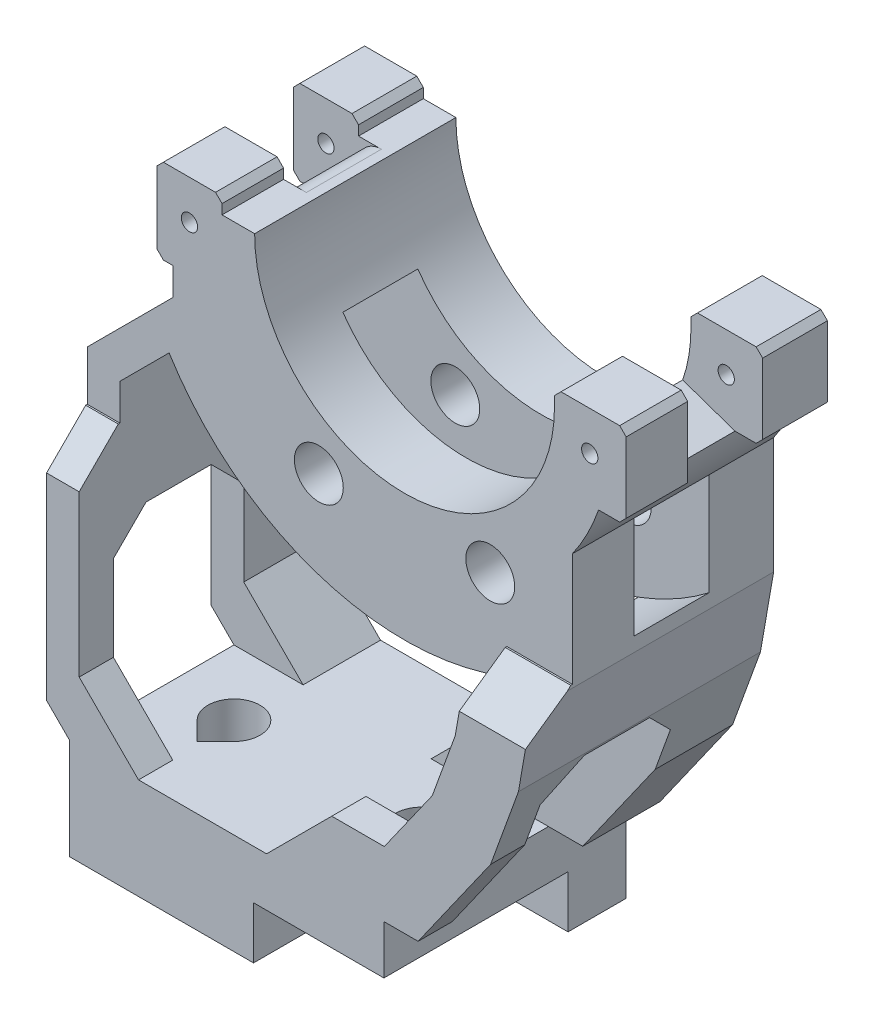
from build123d import *

# Parameters (mm, degrees)
BOSS_EXTRUDE1_DEPTH             = 3.2
BOSS_EXTRUDE2_START             = 3
SKETCH1_3_W                     = 19.3
SKETCH1_3_H                     = 14.85
BOSS_EXTRUDE2_DEPTH             = 3
BOSS_EXTRUDE3_DEPTH             = 3.6
BOSS_EXTRUDE3_DEPTH_BACK        = 8.75
BOSS_EXTRUDE4_REACH             = 42.113
BOSS_EXTRUDE4_DIRECTION_2_REACH = 42.113
CHAMFER1_SIZE                   = 2.4
CUT_EXTRUDE1_DEPTH              = 4
CUT_EXTRUDE1_DEPTH_BACK         = 4
CHAMFER2_SIZE                   = 2
BOSS_EXTRUDE5_START             = -6.175
BOSS_EXTRUDE5_DEPTH             = 12.35
CUT_EXTRUDE2_START              = -2.2
CUT_EXTRUDE2_OUTLINE_R          = 0.5
CUT_EXTRUDE2_DEPTH              = 4.6
CUT_EXTRUDE3_START              = -6.175
SKETCH4_5_R                     = 1.5
SKETCH4_5_R_2                   = 0.5
CUT_EXTRUDE3_DEPTH              = 12.35
BOSS_EXTRUDE6_REACH             = 43.446
BOSS_EXTRUDE6_DIRECTION_2_REACH = 43.446
FILLET1_R                       = 1.4
CHAMFER3_SIZE                   = 0.4
CHAMFER3_SIZE_2                 = 0.283047342


with BuildPart() as part:
    # Sketch1 → Boss-Extrude1 (new body)
    with BuildSketch(Plane(origin=(0, 0, 0), x_dir=(1, 0, 0), z_dir=(0, 1, 0))):
        Polygon((-9.75, 8.75), (-9.75, -6.1), (1.55, -6.1), (1.55, 5.2), (9.55, 5.2), (9.55, 8.75), align=None)
        with BuildLine():
            Line((-4.61862915, -1.13137085), (-5.75, -2.2627417))
            Line((-5.75, -2.2627417), (-6.88137085, -1.13137085))
            ThreePointArc((-6.88137085, -1.13137085), (-5.75, 1.6), (-4.61862915, -1.13137085))
        make_face(mode=Mode.SUBTRACT)
    extrude(amount=-BOSS_EXTRUDE1_DEPTH)

    # Sketch1<3> → Boss-Extrude2 (add)
    with BuildSketch(Plane(origin=(0, 0, 0), x_dir=(1, 0, 0), z_dir=(0, 1, 0)).offset(BOSS_EXTRUDE2_START)):
        with Locations((-0.1, 1.325)):
            Rectangle(SKETCH1_3_W, SKETCH1_3_H)
        with BuildLine():
            Line((-4.61862915, -1.13137085), (-5.75, -2.2627417))
            Line((-5.75, -2.2627417), (-6.88137085, -1.13137085))
            ThreePointArc((-6.88137085, -1.13137085), (-5.75, 1.6), (-4.61862915, -1.13137085))
        make_face(mode=Mode.SUBTRACT)
        with BuildLine():
            Line((6.88137085, -1.13137085), (5.75, -2.2627417))
            Line((5.75, -2.2627417), (4.61862915, -1.13137085))
            ThreePointArc((4.61862915, -1.13137085), (5.75, 1.6), (6.88137085, -1.13137085))
        make_face(mode=Mode.SUBTRACT)
    extrude(amount=-BOSS_EXTRUDE2_DEPTH)

    # Boss-Extrude4: up to this face of the body (flat: up to its plane)
    boss_extrude4_end = Plane(part.part.faces().sort_by_distance((-1.637741867, 0.308250053, 6.1))[0])
    # Sketch2<3> → Boss-Extrude4 (add, up to the picked face)
    with BuildSketch(Plane.XY, mode=Mode.PRIVATE) as boss_extrude4_sk1:
        Polygon((9.575660702, 7), (6.35, 7), (2.35, 3), (11.65, 3), (16.097729758, 9.31), (17.807115613, 14.03), (18.617856015, 18.69), (18.617856015, 18.89), (14.592565903, 18.89), (13.926529786, 15.061735984), (12.519365433, 11.176237735), align=None)
    boss_extrude4_tool1 = split(extrude(boss_extrude4_sk1.sketch, amount=BOSS_EXTRUDE4_REACH, mode=Mode.PRIVATE), bisect_by=boss_extrude4_end, keep=Keep.BOTH, mode=Mode.PRIVATE)
    # Sketch2<3> → Boss-Extrude4 (add, up to the picked face)
    with BuildSketch(Plane.XY, mode=Mode.PRIVATE) as boss_extrude4_sk2:
        Polygon((-11.15, 18.89), (-11.15, 4.4), (-9.75, 3), (-5.507359313, 3), (-9.15, 6.642640687), (-9.15, 18.89), align=None)
    boss_extrude4_tool2 = split(extrude(boss_extrude4_sk2.sketch, amount=BOSS_EXTRUDE4_REACH, mode=Mode.PRIVATE), bisect_by=boss_extrude4_end, keep=Keep.BOTH, mode=Mode.PRIVATE)


with BuildPart() as body_2:
    # Sketch2 → Boss-Extrude3 (new, two sides: drawn at the far end of the back side and taken through both)
    with BuildSketch(Plane.XY.offset(-BOSS_EXTRUDE3_DEPTH_BACK)):
        with BuildLine():
            ThreePointArc((-1.723060387, 23.049083817), (6.015471186, 19.077897228), (14.617856015, 20.364042276))
            Line((14.617856015, 20.364042276), (14.617856015, 19.035363324))
            Line((14.617856015, 19.035363324), (14.592565903, 18.89))
            Line((14.592565903, 18.89), (18.617856015, 18.89))
            Line((18.617856015, 18.89), (18.617856015, 25.832589994))
            ThreePointArc((18.617856015, 25.832589994), (20.329100746, 29.283426738), (20.917856015, 33.09))
            Line((20.917856015, 33.09), (17.517856015, 33.09))
            ThreePointArc((17.517856015, 33.09), (8.317856015, 23.89), (-0.882143985, 33.09))
            Line((-0.882143985, 33.09), (-5.882143985, 33.09))
            Line((-5.882143985, 33.09), (-5.882143985, 27.208167414))
            Line((-5.882143985, 27.208167414), (-11.15, 21.940311399))
            Line((-11.15, 21.940311399), (-11.15, 18.89))
            Line((-11.15, 18.89), (-9.15, 18.89))
            Line((-9.15, 18.89), (-9.15, 21.111884275))
            Line((-9.15, 21.111884275), (-4.467930423, 25.793953852))
            Line((-4.467930423, 25.793953852), (-1.723060387, 23.049083817))
        make_face()
    extrude(amount=BOSS_EXTRUDE3_DEPTH + BOSS_EXTRUDE3_DEPTH_BACK)


with BuildPart() as part_1:
    add(part.part)

    add(body_2.part)  # Boss-Extrude4 merges body 2
    add(boss_extrude4_tool1.solids().sort_by(Axis((12.380692, 9.593109, 0), (0, 0, 1)))[0])
    add(boss_extrude4_tool2.solids().sort_by(Axis((-9.743618, 9.947894, 0), (0, 0, 1)))[0])

    # Boss-Extrude4 direction 2: up to this face of the body (flat: up to its plane)
    boss_extrude4_direction_2_end = Plane(part_1.part.faces().sort_by_distance((-0.1, -0.1, -8.75))[0])
    # Sketch2<3> → Boss-Extrude4 direction 2 (add, up to the picked face)
    with BuildSketch(Plane.XY, mode=Mode.PRIVATE) as boss_extrude4_direction_2_sk1:
        Polygon((9.575660702, 7), (6.35, 7), (2.35, 3), (11.65, 3), (16.097729758, 9.31), (17.807115613, 14.03), (18.617856015, 18.69), (18.617856015, 18.89), (14.592565903, 18.89), (13.926529786, 15.061735984), (12.519365433, 11.176237735), align=None)
    boss_extrude4_direction_2_tool1 = split(extrude(boss_extrude4_direction_2_sk1.sketch, amount=-BOSS_EXTRUDE4_DIRECTION_2_REACH, mode=Mode.PRIVATE), bisect_by=boss_extrude4_direction_2_end, keep=Keep.BOTH, mode=Mode.PRIVATE)
    # Sketch2<3> → Boss-Extrude4 direction 2 (add, up to the picked face)
    with BuildSketch(Plane.XY, mode=Mode.PRIVATE) as boss_extrude4_direction_2_sk2:
        Polygon((-11.15, 18.89), (-11.15, 4.4), (-9.75, 3), (-5.507359313, 3), (-9.15, 6.642640687), (-9.15, 18.89), align=None)
    boss_extrude4_direction_2_tool2 = split(extrude(boss_extrude4_direction_2_sk2.sketch, amount=-BOSS_EXTRUDE4_DIRECTION_2_REACH, mode=Mode.PRIVATE), bisect_by=boss_extrude4_direction_2_end, keep=Keep.BOTH, mode=Mode.PRIVATE)
    add(boss_extrude4_direction_2_tool1.solids().sort_by(Axis((12.380692, 9.593109, 0), (0, 0, -1)))[0])
    add(boss_extrude4_direction_2_tool2.solids().sort_by(Axis((-9.743618, 9.947894, 0), (0, 0, -1)))[0])

    # Chamfer1
    chamfer1_edges = [part_1.edges().sort_by_distance(p)[0] for p in [
        (-10.15, 18.89, 6.1),
        (16.605210959, 18.89, 6.1),
    ]]
    chamfer(chamfer1_edges, length=CHAMFER1_SIZE)

    # Sketch2<5> → Cut-Extrude1 (cut, two sides: drawn at the far end of the back side and taken through both)
    with BuildSketch(Plane.XY.offset(-CUT_EXTRUDE1_DEPTH_BACK)):
        Polygon((9.575660702, 7), (6.35, 7), (2.35, 3), (11.65, 3), (16.097729758, 9.31), (17.75641349, 13.89), (13.502176202, 13.89), (12.519365433, 11.176237735), align=None)
        Polygon((-9.15, 6.642640687), (-9.15, 13.89), (-11.15, 13.89), (-11.15, 4.4), (-9.75, 3), (-5.507359313, 3), align=None)
    extrude(amount=CUT_EXTRUDE1_DEPTH + CUT_EXTRUDE1_DEPTH_BACK, mode=Mode.SUBTRACT)

    # Chamfer2
    chamfer2_edges = [part_1.edges().sort_by_distance(p)[0] for p in [
        (15.629294846, 13.89, 4),
        (15.629294846, 13.89, -4),
        (-10.15, 13.89, 4),
        (-10.15, 13.89, -4),
    ]]
    chamfer(chamfer2_edges, length=CHAMFER2_SIZE)

    # Boss-Extrude5: read off the stored shape, not the designer's step
    # Boss-Extrude5 outline → Boss-Extrude5 (add)
    with BuildSketch(Plane.XY.offset(-2.575).offset(BOSS_EXTRUDE5_START)):
        Polygon((-6.882143985, 34.09), (-6.882143985, 28.89), (-5.882143985, 28.89), (-5.882143985, 33.09), (-2.882143985, 33.09), (-2.882143985, 34.09), align=None)
        with BuildLine():
            Line((21.917856015, 28.962870062), (21.917856015, 34.09))
            Line((21.917856015, 34.09), (17.517856015, 34.09))
            Line((17.517856015, 34.09), (17.517856015, 33.09))
            Line((17.517856015, 33.09), (20.917856015, 33.09))
            ThreePointArc((20.917856015, 33.09), (20.742867518, 30.997372673), (20.222762502, 28.962870062))
            Line((20.222762502, 28.962870062), (21.917856015, 28.962870062))
        make_face()
        with BuildLine():
            ThreePointArc((-6.130248208, 24.131636067), (2.836901124, 16.997792771), (14.294214917, 17.175128519))
            Line((14.294214917, 17.175128519), (14.617856015, 19.035363324))
            Line((14.617856015, 19.035363324), (14.617856015, 20.364042276))
            ThreePointArc((14.617856015, 20.364042276), (6.015471262, 19.077897215), (-1.723060278, 23.049083707))
            Line((-1.723060278, 23.049083707), (-4.467930423, 25.793953852))
            Line((-4.467930423, 25.793953852), (-6.130248208, 24.131636067))
        make_face()
    extrude(amount=BOSS_EXTRUDE5_DEPTH)

    # Cut-Extrude2: read off the stored shape, not the designer's step
    # Cut-Extrude2 outline → Cut-Extrude2 (cut)
    # profile 1 of 2: a face of its own
    with BuildSketch(Plane.XY.offset(-2.575).offset(CUT_EXTRUDE2_START)):
        with BuildLine():
            ThreePointArc((17.517856015, 33.09), (17.390086637, 31.562049888), (17.010327418, 30.076540045))
            Line((17.010327418, 30.076540045), (20.222762502, 28.962870062))
            Line((20.222762502, 28.962870062), (21.917856015, 28.962870062))
            Line((21.917856015, 28.962870062), (21.917856015, 34.09))
            Line((21.917856015, 34.09), (17.517856015, 34.09))
            Line((17.517856015, 34.09), (17.517856015, 33.09))
        make_face()
        with Locations((19.68334966, 31.69)):
            Circle(CUT_EXTRUDE2_OUTLINE_R, mode=Mode.SUBTRACT)
    # profile 2 of 2: a face of its own
    with BuildSketch(Plane.XY.offset(-2.575).offset(CUT_EXTRUDE2_START)):
        with BuildLine():
            Line((-9.15, 23.940311399), (-9.15, 21.111884275))
            Line((-9.15, 21.111884275), (-6.130248208, 24.131636067))
            ThreePointArc((-6.130248208, 24.131636067), (2.836901124, 16.997792771), (14.294214917, 17.175128519))
            ThreePointArc((14.294214917, 17.175128519), (16.543336338, 18.21245069), (18.617856015, 19.565577646))
            Line((18.617856015, 19.565577646), (18.617856015, 25.832589994))
            Line((18.617856015, 25.832589994), (15.838490936, 27.790938726))
            ThreePointArc((15.838490936, 27.790938726), (8.283173059, 23.890065376), (0.757481426, 27.847792825))
            Line((0.757481426, 27.847792825), (-2.882143985, 24.208167414))
            Line((-2.882143985, 24.208167414), (-2.882143985, 34.09))
            Line((-2.882143985, 34.09), (-6.882143985, 34.09))
            Line((-6.882143985, 34.09), (-6.882143985, 28.89))
            Line((-6.882143985, 28.89), (-5.882143985, 28.89))
            Line((-5.882143985, 28.89), (-5.882143985, 27.208167414))
            Line((-5.882143985, 27.208167414), (-9.15, 23.940311399))
        make_face()
        with Locations((-4.882143985, 31.69)):
            Circle(CUT_EXTRUDE2_OUTLINE_R, mode=Mode.SUBTRACT)
    extrude(amount=CUT_EXTRUDE2_DEPTH, mode=Mode.SUBTRACT)

    # Sketch4<5> → Cut-Extrude3 (cut)
    with BuildSketch(Plane.XY.offset(-2.575).offset(CUT_EXTRUDE3_START)):
        with Locations((3.057402253, 22.304471444)):
            Circle(SKETCH4_5_R)
        with Locations((13.578309776, 22.304471444)):
            Circle(SKETCH4_5_R)
        with Locations((-4.882143985, 31.69)):
            Circle(SKETCH4_5_R_2)
        with Locations((19.68334966, 31.69)):
            Circle(SKETCH4_5_R_2)
    extrude(amount=CUT_EXTRUDE3_DEPTH, mode=Mode.SUBTRACT)

    # Boss-Extrude6: up to this face of the body (flat: up to its plane)
    boss_extrude6_end = Plane(part_1.part.faces().sort_by_distance((5.571215805, 24.148263907, 3.6))[0])
    # Sketch4<6> → Boss-Extrude6 (add, up to the picked face)
    with BuildSketch(Plane.XY.offset(-2.575), mode=Mode.PRIVATE) as boss_extrude6_sk1:
        with BuildLine():
            ThreePointArc((4.194316475, 16.597685982), (4.495824105, 16.525215906), (4.798603438, 16.458257419))
            ThreePointArc((4.798603438, 16.458257419), (8.627937882, 16.092828199), (12.441395555, 16.597685982))
            Line((12.441395555, 16.597685982), (8.317856015, 19.29))
            Line((8.317856015, 19.29), (4.194316475, 16.597685982))
        make_face()
    boss_extrude6_tool1 = split(extrude(boss_extrude6_sk1.sketch, amount=BOSS_EXTRUDE6_REACH, mode=Mode.PRIVATE), bisect_by=boss_extrude6_end, keep=Keep.BOTH, mode=Mode.PRIVATE)
    add(boss_extrude6_tool1.solids().sort_by(Axis((8.317856, 17.273432, -2.575), (0, 0, 1)))[0])

    # Boss-Extrude6 direction 2: up to this face of the body (flat: up to its plane)
    boss_extrude6_direction_2_end = Plane(part_1.part.faces().sort_by_distance((-0.1, -2.701599839, -8.75))[0])
    # Sketch4<6> → Boss-Extrude6 direction 2 (add, up to the picked face)
    with BuildSketch(Plane.XY.offset(-2.575), mode=Mode.PRIVATE) as boss_extrude6_direction_2_sk1:
        with BuildLine():
            ThreePointArc((4.194316475, 16.597685982), (4.495824105, 16.525215906), (4.798603438, 16.458257419))
            ThreePointArc((4.798603438, 16.458257419), (8.627937882, 16.092828199), (12.441395555, 16.597685982))
            Line((12.441395555, 16.597685982), (8.317856015, 19.29))
            Line((8.317856015, 19.29), (4.194316475, 16.597685982))
        make_face()
    boss_extrude6_direction_2_tool1 = split(extrude(boss_extrude6_direction_2_sk1.sketch, amount=-BOSS_EXTRUDE6_DIRECTION_2_REACH, mode=Mode.PRIVATE), bisect_by=boss_extrude6_direction_2_end, keep=Keep.BOTH, mode=Mode.PRIVATE)
    add(boss_extrude6_direction_2_tool1.solids().sort_by(Axis((8.317856, 17.273432, -2.575), (0, 0, -1)))[0])

    # Fillet1
    fillet1_edges = [part_1.edges().sort_by_distance(p)[0] for p in [
        (-2.882143985, 33.09, -2.475),
        (-2.882143985, 24.208167414, -2.475),
    ]]
    fillet(fillet1_edges, radius=FILLET1_R)

    # Chamfer3
    # the kernel refuses this chamfer: 0.4, 0.283047342 mm, written as the material it takes off along each edge
    with BuildSketch(Plane(origin=(-6.882143985, 34.09, -1.203673195), x_dir=(1, 0, 0), z_dir=(0, 0, 1)), Plane(origin=(-6.882143985, 28.89, -1.203673195), x_dir=(0, 1, 0), z_dir=(0, 0, 1)), Plane(origin=(-2.882143985, 34.09, -1.203673195), x_dir=(0, -1, 0), z_dir=(0, 0, 1)), Plane(origin=(21.917856015, 28.962870062, -1.203673195), x_dir=(-1, 0, 0), z_dir=(0, 0, 1))) as chamfer3_piece_1:
        Polygon((CHAMFER3_SIZE, 0), (0, -CHAMFER3_SIZE), (0, 0), align=None)
    extrude(amount=5.83234639, mode=Mode.SUBTRACT)
    with BuildSketch(Plane(origin=(17.517856015, 34.09, -1.203673195), x_dir=(0, -1, 0), z_dir=(0, 0, 1)), Plane(origin=(21.917856015, 34.09, -1.203673195), x_dir=(-1, 0, 0), z_dir=(0, 0, 1))) as chamfer3_piece_2:
        Polygon((CHAMFER3_SIZE, 0), (0, CHAMFER3_SIZE), (0, 0), align=None)
    extrude(amount=5.83234639, mode=Mode.SUBTRACT)
    with BuildSketch(Plane(origin=(21.917856015, 34.09, -9.778673195), x_dir=(0, -1, 0), z_dir=(0, 0, 1)), Plane(origin=(21.917856015, 28.962870062, -9.778673195), x_dir=(-1, 0, 0), z_dir=(0, 0, 1)), Plane(origin=(-2.882143985, 34.09, -9.778673195), x_dir=(0, -1, 0), z_dir=(0, 0, 1)), Plane(origin=(-6.882143985, 34.09, -9.778673195), x_dir=(1, 0, 0), z_dir=(0, 0, 1)), Plane(origin=(-6.882143985, 28.89, -9.778673195), x_dir=(0, 1, 0), z_dir=(0, 0, 1))) as chamfer3_piece_3:
        Polygon((CHAMFER3_SIZE, 0), (0, -CHAMFER3_SIZE), (0, 0), align=None)
    extrude(amount=6.03234639, mode=Mode.SUBTRACT)
    with BuildSketch(Plane(origin=(17.517856015, 34.09, -9.778673195), x_dir=(0, -1, 0), z_dir=(0, 0, 1))) as chamfer3_piece_4:
        Polygon((CHAMFER3_SIZE, 0), (0, CHAMFER3_SIZE), (0, 0), align=None)
    extrude(amount=6.03234639, mode=Mode.SUBTRACT)
    with BuildSketch(Plane(origin=(12.441395555, 16.597685982, -4.775), x_dir=(-0.9728915471161905, -0.2312618376426714, 0), z_dir=(0, 0, 1))) as chamfer3_piece_5:
        with BuildLine():
            Line((0.395427827, 0), (CHAMFER3_SIZE_2 * 0.688197210092, -CHAMFER3_SIZE_2 * 0.725523674515))
            Line((CHAMFER3_SIZE_2 * 0.688197210092, -CHAMFER3_SIZE_2 * 0.725523674515), (0, 0))
            ThreePointArc((0, 0), (0.203303091, 0.001148849), (0.395427827, 0))
        make_face()
    extrude(amount=4.6, mode=Mode.SUBTRACT)
    with BuildSketch(Plane(origin=(4.194316475, 16.597685982, -0.175), x_dir=(0.972121252868909, -0.23447871912091042, 0), z_dir=(0, 0, -1))) as chamfer3_piece_6:
        with BuildLine():
            Line((0.282967544, 0), (CHAMFER3_SIZE * 0.685793544933, -CHAMFER3_SIZE * 0.7277961353))
            Line((CHAMFER3_SIZE * 0.685793544933, -CHAMFER3_SIZE * 0.7277961353), (0, 0))
            ThreePointArc((0, 0), (0.141721271, 0.000588763), (0.282967544, 0))
        make_face()
    extrude(amount=4.6, mode=Mode.SUBTRACT)


solid = part_1.part
